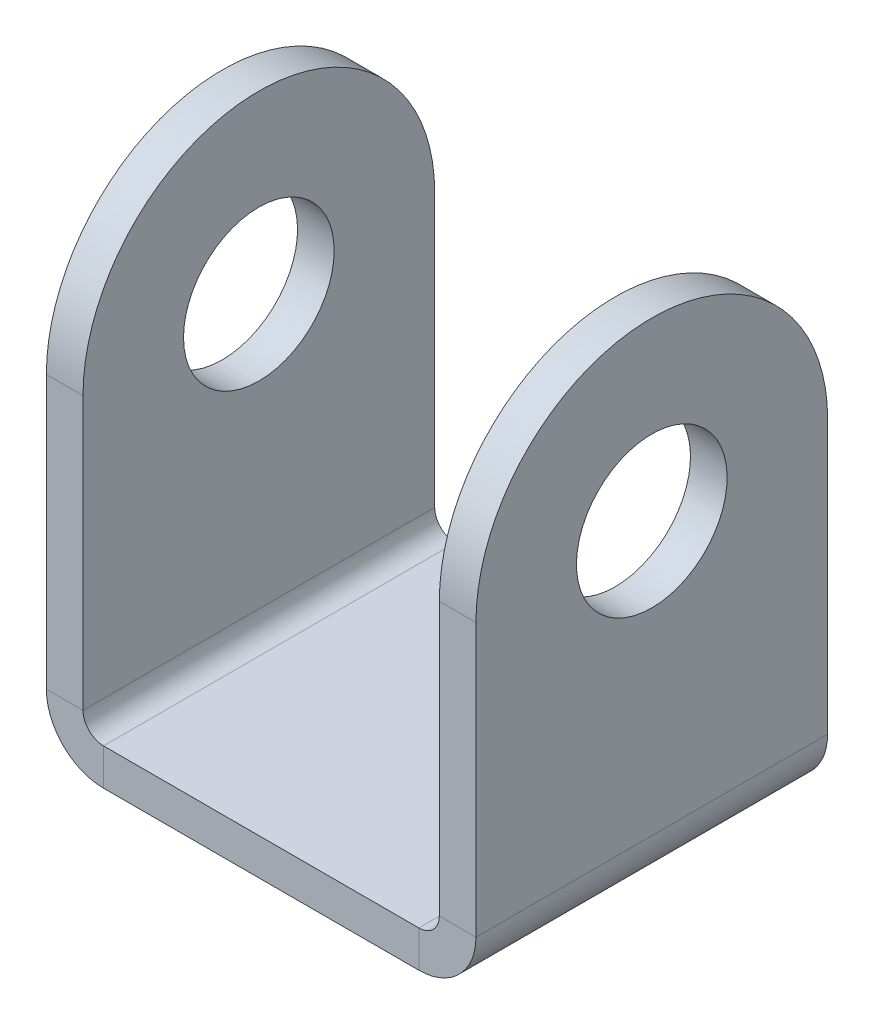
from build123d import *

# Parameters (mm, degrees)
SKETCH1_W                      = 15.24
SKETCH1_H                      = 15.24
BASE_FLANGE1_DEPTH             = 1.5875
EDGE_FLANGE1_STRIP_W           = 8.228
EDGE_FLANGE1_STRIP_H           = 1.5875
EDGE_FLANGE1_STRIP_CUT_DEPTH   = 15.24
EDGE_FLANGE1_STRIP_2_W         = 8.228
EDGE_FLANGE1_STRIP_2_H         = 1.5875
EDGE_FLANGE1_STRIP_CUT_2_DEPTH = 15.24
EDGE_FLANGE1_DEPTH             = 15.24
EDGE_FLANGE1_BEND_DEPTH        = 15.24
CUT_EXTRUDE2_REACH             = 30.592
CUT_EXTRUDE1_REACH             = 30.592
SKETCH13_R                     = 3.2639


# Sheet-metal steps are written as plain solids
with BuildPart() as part:
    # Sketch1 → Base-Flange1 (new body)
    with BuildSketch(Plane(origin=(0, 0, 0), x_dir=(1, 0, 0), z_dir=(0, 1, 0))):
        Rectangle(SKETCH1_W, SKETCH1_H)
    extrude(amount=-BASE_FLANGE1_DEPTH)

    # Edge-Flange1 strip (across the edge) → Edge-Flange1 strip cut (cut)
    with BuildSketch(Plane(origin=(-7.72, 0, -7.62), x_dir=(1, 0, 0), z_dir=(0, 0, 1))):
        with Locations((-3.225, -0.79375)):
            Rectangle(EDGE_FLANGE1_STRIP_W, EDGE_FLANGE1_STRIP_H)
    extrude(amount=EDGE_FLANGE1_STRIP_CUT_DEPTH, mode=Mode.SUBTRACT)

    # Edge-Flange1 strip 2 (across the edge) → Edge-Flange1 strip cut 2 (cut)
    with BuildSketch(Plane(origin=(7.72, 0, 7.62), x_dir=(-1, 0, 0), z_dir=(0, 0, -1))):
        with Locations((-3.225, -0.79375)):
            Rectangle(EDGE_FLANGE1_STRIP_2_W, EDGE_FLANGE1_STRIP_2_H)
    extrude(amount=EDGE_FLANGE1_STRIP_CUT_2_DEPTH, mode=Mode.SUBTRACT)

    # Edge-Flange1 section (across the edge) → Edge-Flange1 (add)
    with BuildSketch(Plane(origin=(-7.72, 0, -7.62), x_dir=(1, 0, 0), z_dir=(0, 0, 1))):
        with BuildLine():
            Line((-1.5875, 0.889), (-1.5875, 20.32))
            Line((-1.5875, 20.32), (0, 20.32))
            Line((0, 20.32), (0, 0.889))
            ThreePointArc((0, 0.889), (0.260382072, 0.260382072), (0.889, 0))
            Line((0.889, 0), (0.889, -1.5875))
            ThreePointArc((0.889, -1.5875), (-0.862149944, -0.862149944), (-1.5875, 0.889))
        make_face()
    extrude(amount=EDGE_FLANGE1_DEPTH)

    # Edge-Flange1 section 2 (across the edge) → Edge-Flange1 bend (add)
    with BuildSketch(Plane(origin=(7.72, 0, 7.62), x_dir=(-1, 0, 0), z_dir=(0, 0, -1))):
        with BuildLine():
            Line((-1.5875, 0.889), (-1.5875, 20.32))
            Line((-1.5875, 20.32), (0, 20.32))
            Line((0, 20.32), (0, 0.889))
            ThreePointArc((0, 0.889), (0.260382072, 0.260382072), (0.889, 0))
            Line((0.889, 0), (0.889, -1.5875))
            ThreePointArc((0.889, -1.5875), (-0.862149944, -0.862149944), (-1.5875, 0.889))
        make_face()
    extrude(amount=EDGE_FLANGE1_BEND_DEPTH)

    # Cut-Extrude2: up to this face of the body (flat: up to its plane)
    cut_extrude2_end = Plane(part.part.faces().sort_by_distance((9.3075, 10.6045, 0))[0])
    # Sketch14 → Cut-Extrude2 (cut, up to the picked face)
    with BuildSketch(Plane.ZY.offset(9.3075), mode=Mode.PRIVATE) as cut_extrude2_sk1:
        with BuildLine():
            Line((-7.62, 20.32), (-7.62, 12.7))
            ThreePointArc((-7.62, 12.7), (-5.388153673, 18.088153673), (0, 20.32))
            Line((0, 20.32), (-7.62, 20.32))
        make_face()
    cut_extrude2_tool1 = split(extrude(cut_extrude2_sk1.sketch, amount=-CUT_EXTRUDE2_REACH, mode=Mode.PRIVATE), bisect_by=cut_extrude2_end, keep=Keep.BOTH, mode=Mode.PRIVATE)
    # Sketch14 → Cut-Extrude2 (cut, up to the picked face)
    with BuildSketch(Plane.ZY.offset(9.3075), mode=Mode.PRIVATE) as cut_extrude2_sk2:
        with BuildLine():
            Line((7.62, 20.32), (0, 20.32))
            ThreePointArc((0, 20.32), (5.388153673, 18.088153673), (7.62, 12.7))
            Line((7.62, 12.7), (7.62, 20.32))
        make_face()
    cut_extrude2_tool2 = split(extrude(cut_extrude2_sk2.sketch, amount=-CUT_EXTRUDE2_REACH, mode=Mode.PRIVATE), bisect_by=cut_extrude2_end, keep=Keep.BOTH, mode=Mode.PRIVATE)
    add(cut_extrude2_tool1.solids().sort_by(Axis((-9.3075, 18.617936, -5.917936), (1, 0, 0)))[0], mode=Mode.SUBTRACT)
    add(cut_extrude2_tool2.solids().sort_by(Axis((-9.3075, 18.617936, 5.917936), (1, 0, 0)))[0], mode=Mode.SUBTRACT)

    # Cut-Extrude1: up to this face of the body (flat: up to its plane)
    cut_extrude1_end = Plane(part.part.faces().sort_by_distance((9.3075, 9.868138134, 0))[0])
    # Sketch13 → Cut-Extrude1 (cut, up to the picked face)
    with BuildSketch(Plane.ZY.offset(9.3075), mode=Mode.PRIVATE) as cut_extrude1_sk1:
        with Locations(Location((0, 12.7, 0), (0, 0, 270))):
            Circle(SKETCH13_R)
    cut_extrude1_tool1 = split(extrude(cut_extrude1_sk1.sketch, amount=-CUT_EXTRUDE1_REACH, mode=Mode.PRIVATE), bisect_by=cut_extrude1_end, keep=Keep.BOTH, mode=Mode.PRIVATE)
    add(cut_extrude1_tool1.solids().sort_by(Axis((-9.3075, 12.7, 0), (1, 0, 0)))[0], mode=Mode.SUBTRACT)


solid = part.part
